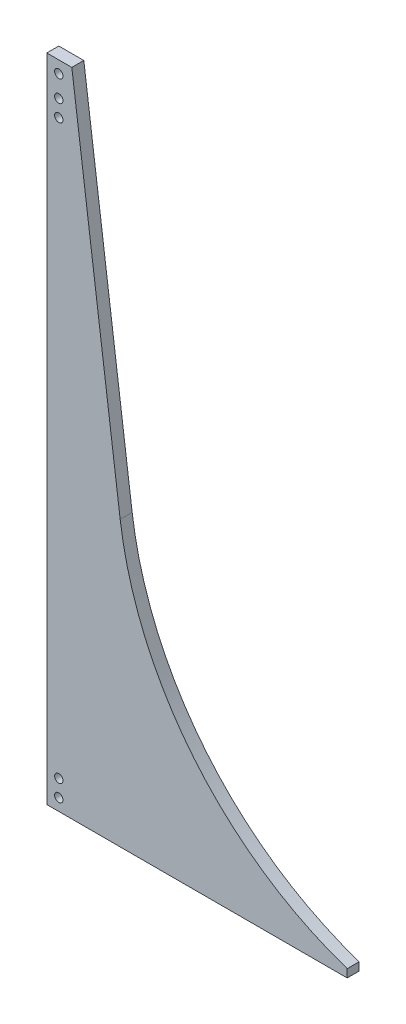
from build123d import *

# Parameters (mm, degrees)
BOSS_EXTRUDE1_DEPTH = 9.128125
SKETCH2_R           = 6.35
CUT_EXTRUDE1_DEPTH  = 1092.170697308


with BuildPart() as part:
    # Sketch1 → Boss-Extrude1 (new, symmetric)
    with BuildSketch(Plane.XY):
        with BuildLine():
            Line((0, 0), (0, 990.6))
            Line((0, 990.6), (38.1, 990.6))
            Line((38.1, 990.6), (111.667415652, 431.8))
            ThreePointArc((111.667415652, 431.8), (224.333601197, 172.553452706), (457.2, 12.317121128))
            Line((457.2, 12.317121128), (457.2, 0))
            Line((457.2, 0), (0, 0))
        make_face()
    extrude(amount=BOSS_EXTRUDE1_DEPTH, both=True)

    # Sketch2 → Cut-Extrude1 (cut, through all)
    with BuildSketch(Plane.XY.offset(9.128125)):
        with Locations((18.25625, 972.34375)):
            Circle(SKETCH2_R)
        with Locations((18.25625, 18.25625)):
            Circle(SKETCH2_R)
        with Locations((18.25625, 43.65625)):
            Circle(SKETCH2_R)
        with Locations((18.25625, 939.8)):
            Circle(SKETCH2_R)
        with Locations((18.25625, 914.4)):
            Circle(SKETCH2_R)
    extrude(amount=-CUT_EXTRUDE1_DEPTH, mode=Mode.SUBTRACT)


solid = part.part
